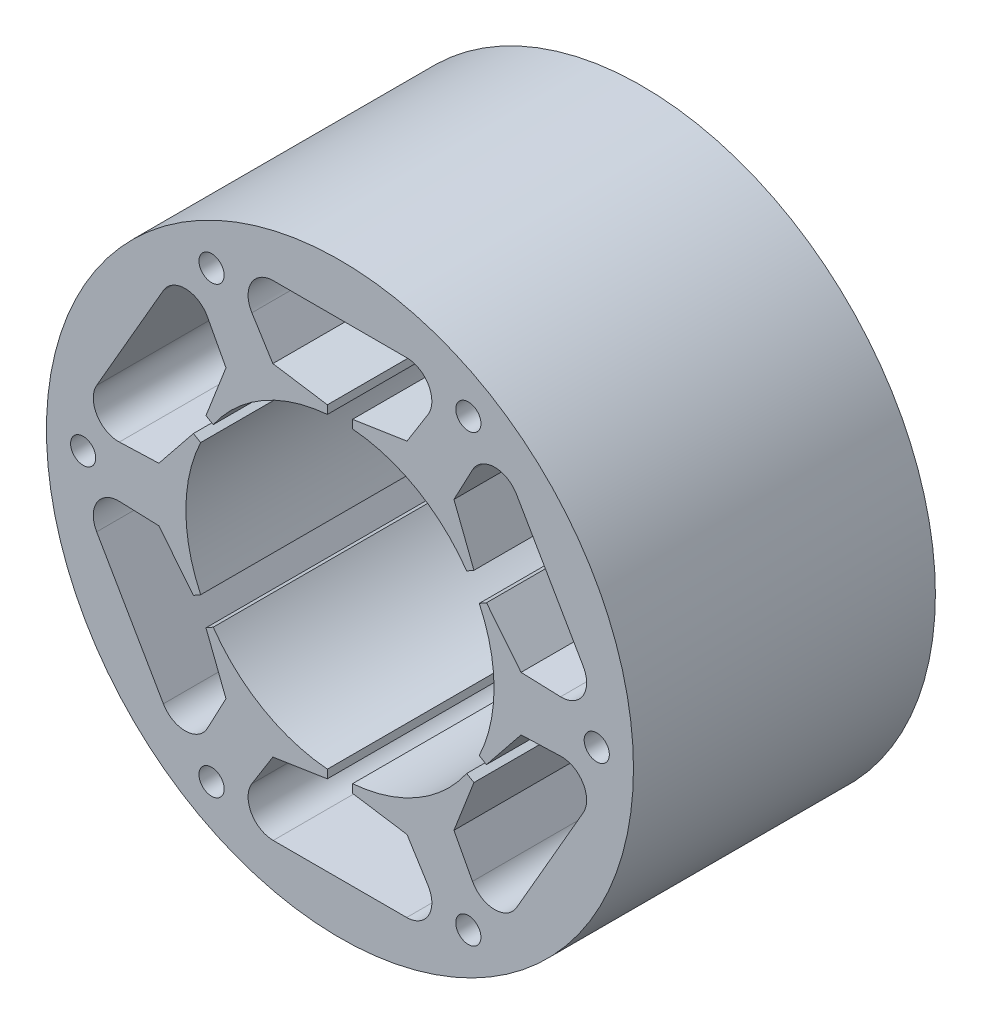
from build123d import *

# Parameters (mm, degrees)
IZIM2_R                     = 35
IZIM2_R_2                   = 1.5
Y_KSEKLIK_EKSTR_ZYON1_DEPTH = 36


with BuildPart() as part:
    # Çizim2 → Yükseklik-Ekstrüzyon1 (new body)
    with BuildSketch(Plane.XY):
        Circle(IZIM2_R)
        with Locations((-15.31013221, -26.517926859)):
            Circle(IZIM2_R_2, mode=Mode.SUBTRACT)
        with Locations((30.62026442, 0)):
            Circle(IZIM2_R_2, mode=Mode.SUBTRACT)
        with Locations((-15.31013221, 26.517926859)):
            Circle(IZIM2_R_2, mode=Mode.SUBTRACT)
        with Locations((15.31013221, 26.517926859)):
            Circle(IZIM2_R_2, mode=Mode.SUBTRACT)
        with Locations((15.31013221, -26.517926859)):
            Circle(IZIM2_R_2, mode=Mode.SUBTRACT)
        with Locations((-30.62026442, 0)):
            Circle(IZIM2_R_2, mode=Mode.SUBTRACT)
        with BuildLine():
            Line((-15.110106202, 10.455874691), (-15.976131606, 10.955874691))
            Line((-15.976131606, 10.955874691), (-13.59215701, 17.085039816))
            Line((-13.59215701, 17.085039816), (-15.806258625, 21.250103325))
            ThreePointArc((-15.806258625, 21.250103325), (-18.402735589, 22.841478137), (-21.05330993, 21.341937514))
            Line((-21.05330993, 21.341937514), (-29.009315019, 7.561732477))
            ThreePointArc((-29.009315019, 7.561732477), (-28.982668121, 4.516497451), (-26.306258625, 3.063569846))
            Line((-26.306258625, 3.063569846), (-21.59215701, 3.228633355))
            Line((-21.59215701, 3.228633355), (-17.476131606, 8.35779848))
            Line((-17.476131606, 8.35779848), (-16.610106202, 7.85779848))
            ThreePointArc((-16.610106202, 7.85779848), (-18.375, 0), (-16.610106202, -7.85779848))
            Line((-16.610106202, -7.85779848), (-17.476131606, -8.35779848))
            Line((-17.476131606, -8.35779848), (-21.59215701, -3.228633355))
            Line((-21.59215701, -3.228633355), (-26.306258625, -3.063569846))
            ThreePointArc((-26.306258625, -3.063569846), (-28.982668121, -4.516497451), (-29.009315018, -7.561732476))
            Line((-29.009315018, -7.561732476), (-21.05330993, -21.341937514))
            ThreePointArc((-21.05330993, -21.341937514), (-18.402735589, -22.841478137), (-15.806258625, -21.250103325))
            Line((-15.806258625, -21.250103325), (-13.59215701, -17.085039816))
            Line((-13.59215701, -17.085039816), (-15.976131606, -10.955874691))
            Line((-15.976131606, -10.955874691), (-15.110106202, -10.455874691))
            ThreePointArc((-15.110106202, -10.455874691), (-9.1875, -15.913216795), (-1.5, -18.313673171))
            Line((-1.5, -18.313673171), (-1.5, -19.313673171))
            Line((-1.5, -19.313673171), (-8, -20.313673171))
            Line((-8, -20.313673171), (-10.5, -24.313673171))
            ThreePointArc((-10.5, -24.313673171), (-10.579932532, -27.357975588), (-7.956005088, -28.903669991))
            Line((-7.956005088, -28.903669991), (7.956005088, -28.903669991))
            ThreePointArc((7.956005088, -28.903669991), (10.579932532, -27.357975588), (10.5, -24.313673171))
            Line((10.5, -24.313673171), (8, -20.313673171))
            Line((8, -20.313673171), (1.5, -19.313673171))
            Line((1.5, -19.313673171), (1.5, -18.313673171))
            ThreePointArc((1.5, -18.313673171), (9.1875, -15.913216795), (15.110106202, -10.455874691))
            Line((15.110106202, -10.455874691), (15.976131606, -10.955874691))
            Line((15.976131606, -10.955874691), (13.59215701, -17.085039816))
            Line((13.59215701, -17.085039816), (15.806258625, -21.250103325))
            ThreePointArc((15.806258625, -21.250103325), (18.402735589, -22.841478137), (21.05330993, -21.341937514))
            Line((21.05330993, -21.341937514), (29.009315019, -7.561732476))
            ThreePointArc((29.009315019, -7.561732476), (28.982668121, -4.516497451), (26.306258625, -3.063569846))
            Line((26.306258625, -3.063569846), (21.59215701, -3.228633355))
            Line((21.59215701, -3.228633355), (17.476131606, -8.35779848))
            Line((17.476131606, -8.35779848), (16.610106202, -7.85779848))
            ThreePointArc((16.610106202, -7.85779848), (18.375, 0), (16.610106202, 7.85779848))
            Line((16.610106202, 7.85779848), (17.476131606, 8.35779848))
            Line((17.476131606, 8.35779848), (21.59215701, 3.228633355))
            Line((21.59215701, 3.228633355), (26.306258625, 3.063569846))
            ThreePointArc((26.306258625, 3.063569846), (28.982668121, 4.516497451), (29.009315018, 7.561732476))
            Line((29.009315018, 7.561732476), (21.05330993, 21.341937514))
            ThreePointArc((21.05330993, 21.341937514), (18.402735589, 22.841478137), (15.806258625, 21.250103325))
            Line((15.806258625, 21.250103325), (13.59215701, 17.085039816))
            Line((13.59215701, 17.085039816), (15.976131606, 10.955874691))
            Line((15.976131606, 10.955874691), (15.110106202, 10.455874691))
            ThreePointArc((15.110106202, 10.455874691), (9.1875, 15.913216795), (1.5, 18.313673171))
            Line((1.5, 18.313673171), (1.5, 19.313673171))
            Line((1.5, 19.313673171), (8, 20.313673171))
            Line((8, 20.313673171), (10.5, 24.313673171))
            ThreePointArc((10.5, 24.313673171), (10.579932532, 27.357975588), (7.956005088, 28.903669991))
            Line((7.956005088, 28.903669991), (-7.956005088, 28.903669991))
            ThreePointArc((-7.956005088, 28.903669991), (-10.579932532, 27.357975588), (-10.5, 24.313673171))
            Line((-10.5, 24.313673171), (-8, 20.313673171))
            Line((-8, 20.313673171), (-1.5, 19.313673171))
            Line((-1.5, 19.313673171), (-1.5, 18.313673171))
            ThreePointArc((-1.5, 18.313673171), (-9.1875, 15.913216795), (-15.110106202, 10.455874691))
        make_face(mode=Mode.SUBTRACT)
    extrude(amount=Y_KSEKLIK_EKSTR_ZYON1_DEPTH)


solid = part.part
